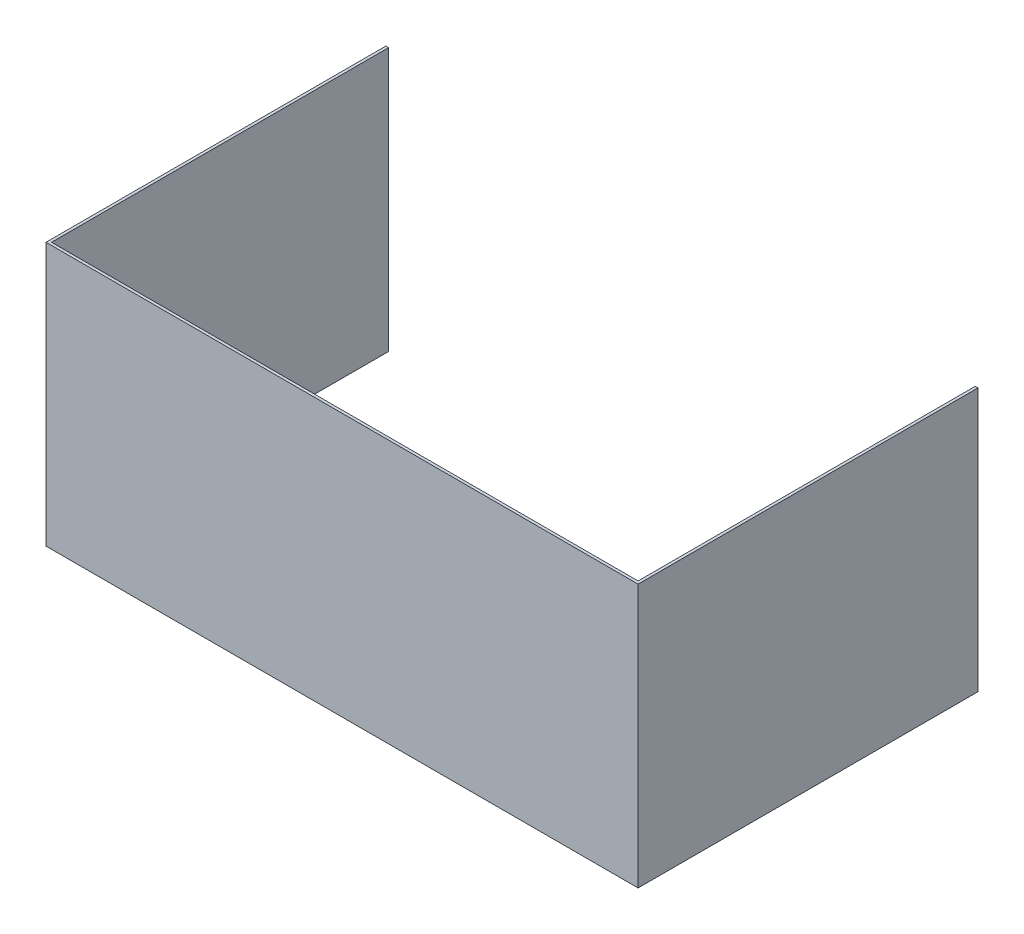
from build123d import *

# Parameters (mm, degrees)
EXTRUDE_THIN1_DEPTH = 304.8


with BuildPart() as part:
    # Sketch1 → Extrude-Thin1 (new body)
    with BuildSketch(Plane(origin=(0, 0, 0), x_dir=(1, 0, 0), z_dir=(0, 1, 0))):
        Polygon((-342.9, 196.85), (-342.9, -196.85), (342.9, -196.85), (342.9, 196.85), (339.725, 196.85), (339.725, -193.675), (-339.725, -193.675), (-339.725, 196.85), align=None)
    extrude(amount=EXTRUDE_THIN1_DEPTH)


solid = part.part
